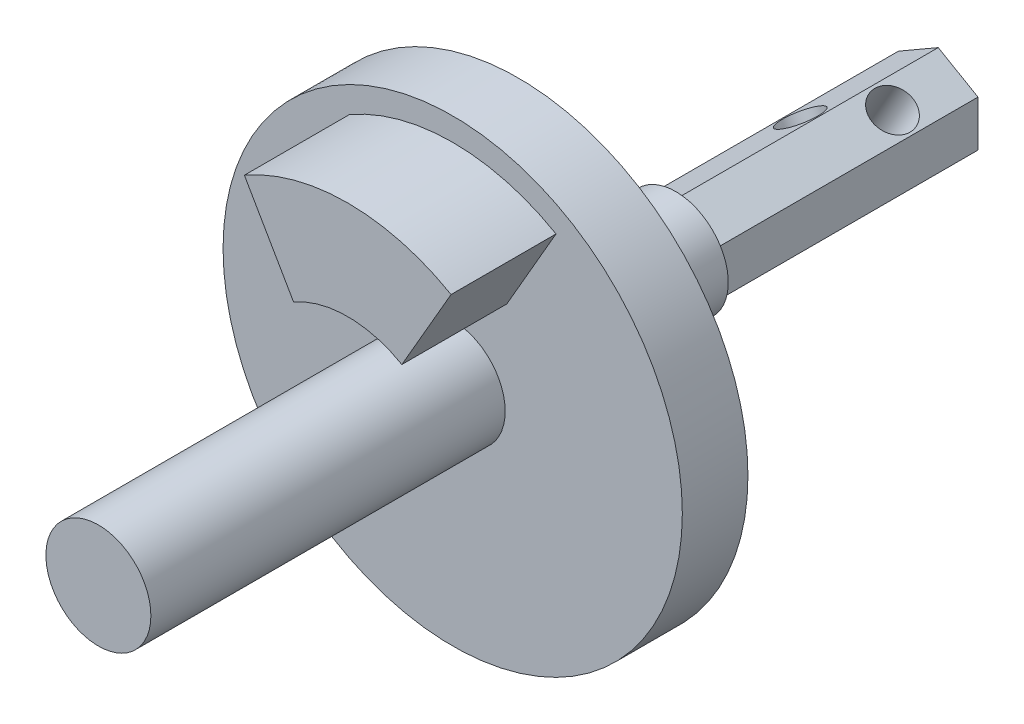
from build123d import *

# Parameters (mm, degrees)
SKETCH1_R           = 17.5
BOSS_EXTRUDE1_DEPTH = 2.5
BOSS_EXTRUDE2_DEPTH = 8
SKETCH3_R           = 4
BOSS_EXTRUDE3_DEPTH = 27
BOSS_EXTRUDE4_START = 12
SKETCH7_R           = 4
BOSS_EXTRUDE4_DEPTH = 12
BOSS_EXTRUDE5_DEPTH = 20
SKETCH10_R          = 1.55
CUT_EXTRUDE1_DEPTH  = 6.1
SKETCH11_R          = 1.55
CUT_EXTRUDE4_DEPTH  = 6.1


with BuildPart() as part:
    # Sketch1 → Boss-Extrude1 (new, symmetric)
    with BuildSketch(Plane.XY):
        Circle(SKETCH1_R)
    extrude(amount=BOSS_EXTRUDE1_DEPTH, both=True)

    # Sketch2 → Boss-Extrude2 (add)
    with BuildSketch(Plane.XY.offset(2.5)):
        with BuildLine():
            Line((7.875, 13.63990011), (4.125, 7.144709581))
            ThreePointArc((4.125, 7.144709581), (0, 8.25), (-4.125, 7.144709581))
            Line((-4.125, 7.144709581), (-7.875, 13.63990011))
            ThreePointArc((-7.875, 13.63990011), (0, 15.75), (7.875, 13.63990011))
        make_face()
    extrude(amount=BOSS_EXTRUDE2_DEPTH)

    # Sketch3 → Boss-Extrude3 (add)
    with BuildSketch(Plane.XY.offset(2.5)):
        Circle(SKETCH3_R)
    extrude(amount=BOSS_EXTRUDE3_DEPTH)

    # Sketch7 → Boss-Extrude4 (add)
    with BuildSketch(Plane(origin=(0, 0, -2.5), x_dir=(-1, 0, 0), z_dir=(0, 0, -1)).offset(BOSS_EXTRUDE4_START)):
        Circle(SKETCH7_R)
    extrude(amount=-BOSS_EXTRUDE4_DEPTH)

    # Sketch9 → Boss-Extrude5 (add)
    with BuildSketch(Plane(origin=(0, 0, -14.5), x_dir=(-1, 0, 0), z_dir=(0, 0, -1))):
        Polygon((0, 3.5), (-3.031088913, 1.75), (-3.031088913, -1.75), (0, -3.5), (3.031088913, -1.75), (3.031088913, 1.75), align=None)
    extrude(amount=BOSS_EXTRUDE5_DEPTH)

    # Sketch10 → Cut-Extrude1 (cut)
    with BuildSketch(Plane(origin=(-1.515544457, -2.625, 0), x_dir=(0.866025403784435, -0.5000000000000062, 0), z_dir=(-0.5000000000000062, -0.866025403784435, 0))):
        with Locations((0, -29.5)):
            Circle(SKETCH10_R)
    extrude(amount=-CUT_EXTRUDE1_DEPTH, mode=Mode.SUBTRACT)

    # Sketch11 → Cut-Extrude4 (cut)
    with BuildSketch(Plane(origin=(1.515544457, -2.625, 0), x_dir=(0, 0, 1), z_dir=(-0.49999999999999717, 0.8660254037844404, 0))):
        with Locations((-25.5, 0)):
            Circle(SKETCH11_R)
    extrude(amount=CUT_EXTRUDE4_DEPTH, mode=Mode.SUBTRACT)


solid = part.part
